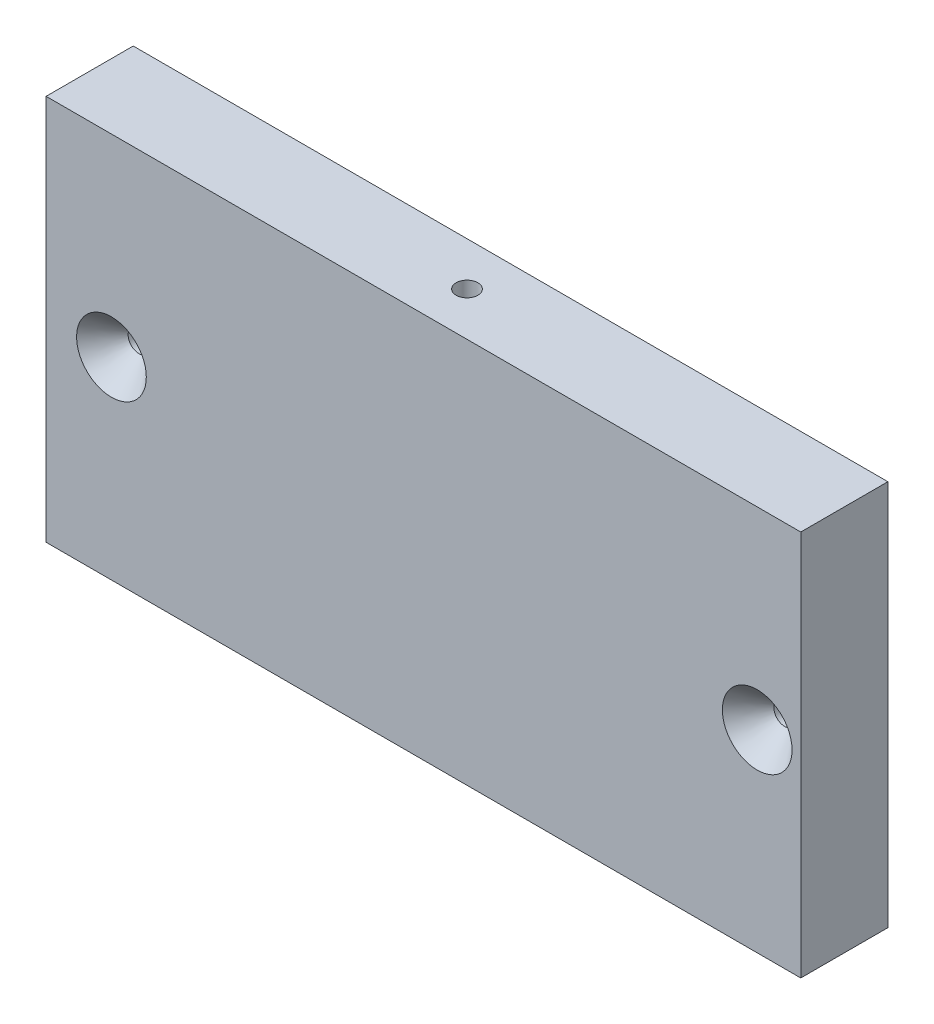
from build123d import *

# Parameters (mm, degrees)
SKETCH2_W           = 110
SKETCH2_H           = 56.3
BOSS_EXTRUDE1_DEPTH = 12.7
HOLE_D              = 3.175
HOLE_DEPTH          = 31.75
HOLE_CSINK_D        = 10.16
HOLE_CSINK_ANGLE    = 82
HOLE_TIP            = 0.953866233
HOLE1_D             = 3.175
HOLE1_DEPTH         = 31.75
HOLE1_CSINK_D       = 10.16
HOLE1_CSINK_ANGLE   = 82
HOLE1_TIP           = 0.953866233


with BuildPart() as part:
    # Sketch2 → Boss-Extrude1 (new body)
    with BuildSketch(Plane.XY):
        with Locations((-286.304465963, 40.85)):
            Rectangle(SKETCH2_W, SKETCH2_H)
    extrude(amount=-BOSS_EXTRUDE1_DEPTH)

    # Hole
    with Locations(Plane(origin=(-124.004465969, 277.286738577, 0), x_dir=(-1, 0, 0), z_dir=(0, 0, 1))):
        with Locations((113.649999994, 236.436738577), (207.774999994, 236.436738577)):
            CounterSinkHole(HOLE_D / 2, HOLE_CSINK_D / 2, depth=HOLE_DEPTH, counter_sink_angle=HOLE_CSINK_ANGLE)
            with Locations((0, 0, -(HOLE_DEPTH + HOLE_TIP / 2))):  # 118° drill point
                Cone(0, HOLE_D / 2, HOLE_TIP, mode=Mode.SUBTRACT)

    # Hole1
    with Locations(Plane(origin=(-124.004465969, 88.05, -14.975709941), x_dir=(1, 0, 0), z_dir=(0, 1, 0))):
        with Locations((-162.299999994, -8.625709941), (-113.649999994, 50.157623392), (-113.649999994, 102.590956725), (162.299999994, -8.625709941), (113.649999994, 50.157623392), (113.649999994, 102.590956725), (63.85, 161.374290059), (0, 161.374290059), (-63.85, 161.374290059)):
            CounterSinkHole(HOLE1_D / 2, HOLE1_CSINK_D / 2, depth=HOLE1_DEPTH, counter_sink_angle=HOLE1_CSINK_ANGLE)
            with Locations((0, 0, -(HOLE1_DEPTH + HOLE1_TIP / 2))):  # 118° drill point
                Cone(0, HOLE1_D / 2, HOLE1_TIP, mode=Mode.SUBTRACT)


solid = part.part
